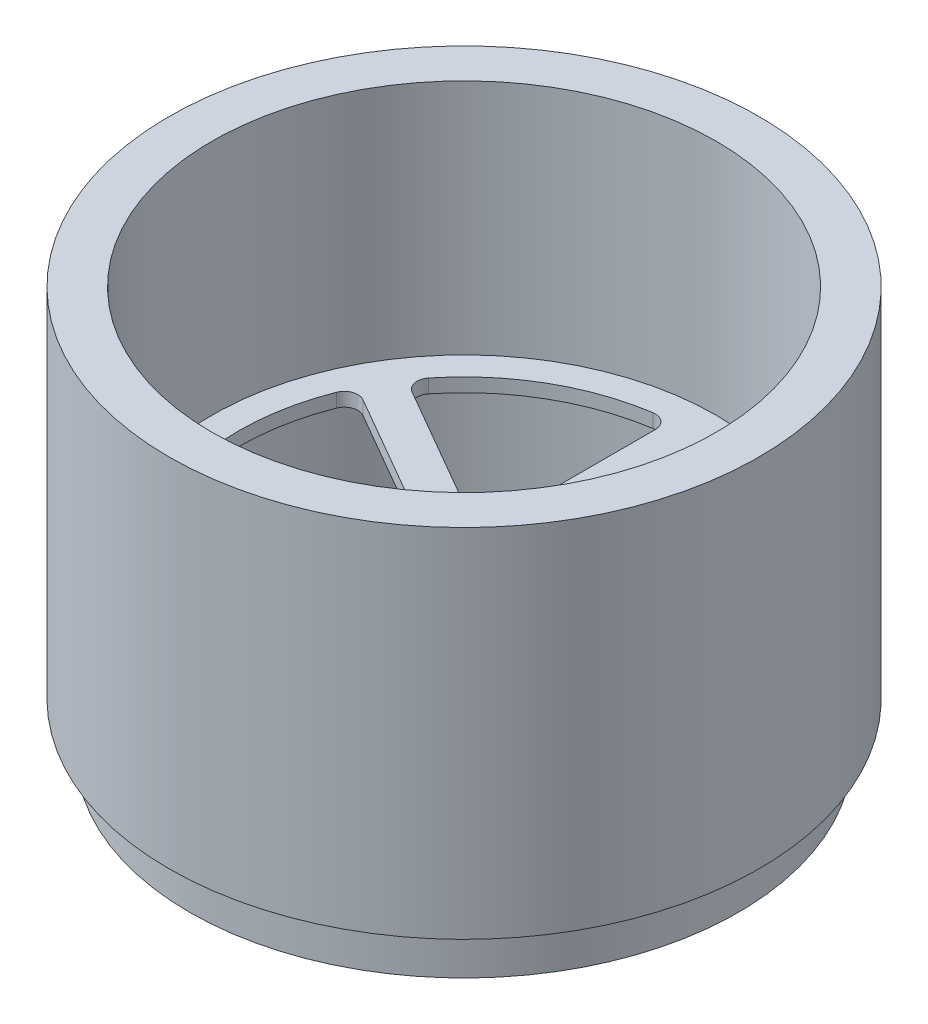
from build123d import *

# Parameters (mm, degrees)
SKETCH1_R           = 21.5
SKETCH1_R_2         = 18.38
BOSS_EXTRUDE1_DEPTH = 29.5
SKETCH3_R           = 21.5
BOSS_EXTRUDE2_DEPTH = 1
SKETCH4_R           = 2
SKETCH4_R_2         = 0.75
BOSS_EXTRUDE3_DEPTH = 3.8
SKETCH5_OUTSIDE_W   = 58.518
SKETCH5_OUTSIDE_H   = 58.518
SKETCH5_OUTSIDE_R   = 20
CUT_EXTRUDE1_DEPTH  = 3.5
CUT_EXTRUDE2_REACH  = 37.488
CIRPATTERN1_COUNT   = 6


with BuildPart() as part:
    # Sketch1 → Boss-Extrude1 (new body)
    with BuildSketch(Plane(origin=(0, 0, 0), x_dir=(1, 0, 0), z_dir=(0, 1, 0))):
        Circle(SKETCH1_R)
        Circle(SKETCH1_R_2, mode=Mode.SUBTRACT)
    extrude(amount=BOSS_EXTRUDE1_DEPTH)

    # Sketch3 → Boss-Extrude2 (add)
    with BuildSketch(Plane(origin=(0, 11.2, 0), x_dir=(-1, 0, 0), z_dir=(0, -1, 0))):
        Circle(SKETCH3_R)
    extrude(amount=-BOSS_EXTRUDE2_DEPTH)

    # Sketch4 → Boss-Extrude3 (add)
    with BuildSketch(Plane(origin=(0, 11.2, 0), x_dir=(-1, 0, 0), z_dir=(0, -1, 0))):
        Circle(SKETCH4_R)
        Circle(SKETCH4_R_2, mode=Mode.SUBTRACT)
    extrude(amount=BOSS_EXTRUDE3_DEPTH)

    # Sketch5 outside → Cut-Extrude1 (cut)
    with BuildSketch(Plane(origin=(0, 0, 0), x_dir=(1, 0, 0), z_dir=(0, 1, 0))):
        Rectangle(SKETCH5_OUTSIDE_W, SKETCH5_OUTSIDE_H)
        Circle(SKETCH5_OUTSIDE_R, mode=Mode.SUBTRACT)
    extrude(amount=CUT_EXTRUDE1_DEPTH, mode=Mode.SUBTRACT)

    # Sketch6 → Cut-Extrude2 (cut, up to next)
    with BuildSketch(Plane(origin=(0, 11.2, 0), x_dir=(-1, 0, 0), z_dir=(0, -1, 0)), mode=Mode.PRIVATE) as cut_extrude2_sk1:
        with BuildLine():
            Line((1.311528297, -4.358954791), (1.311528297, -15.245444515))
            ThreePointArc((1.311528297, -15.245444515), (1.659572625, -16.003701596), (2.461435901, -16.234144525))
            ThreePointArc((2.461435901, -16.234144525), (8.209843408, -14.219865905), (12.828463617, -10.248738282))
            ThreePointArc((12.828463617, -10.248738282), (13.029825824, -9.439082851), (12.547178093, -8.75853908))
            Line((12.547178093, -8.75853908), (3.119201435, -3.315294219))
            ThreePointArc((3.119201435, -3.315294219), (2.601197124, -3.181481713), (2.088346263, -3.333857065))
            ThreePointArc((2.088346263, -3.333857065), (1.966964225, -3.406881974), (1.843031779, -3.475489448))
            ThreePointArc((1.843031779, -3.475489448), (1.454645424, -3.843443646), (1.311528297, -4.358954791))
        make_face()
    cut_extrude2_tool1 = extrude(cut_extrude2_sk1.sketch, amount=-CUT_EXTRUDE2_REACH, mode=Mode.PRIVATE) & part.part
    cut_extrude2 = cut_extrude2_tool1.solids().sort_by_distance((-5.765973, 11.2, 9.986958))[0]
    add(cut_extrude2, mode=Mode.SUBTRACT)

    # CirPattern1: Cut-Extrude2 ×6 about axis
    cirpattern1_axis = Axis((0, 7.4, 0), (0, -1, 0))
    for i in range(1, CIRPATTERN1_COUNT):
        add(cut_extrude2.rotate(cirpattern1_axis, i * 360 / CIRPATTERN1_COUNT), mode=Mode.SUBTRACT)


solid = part.part
